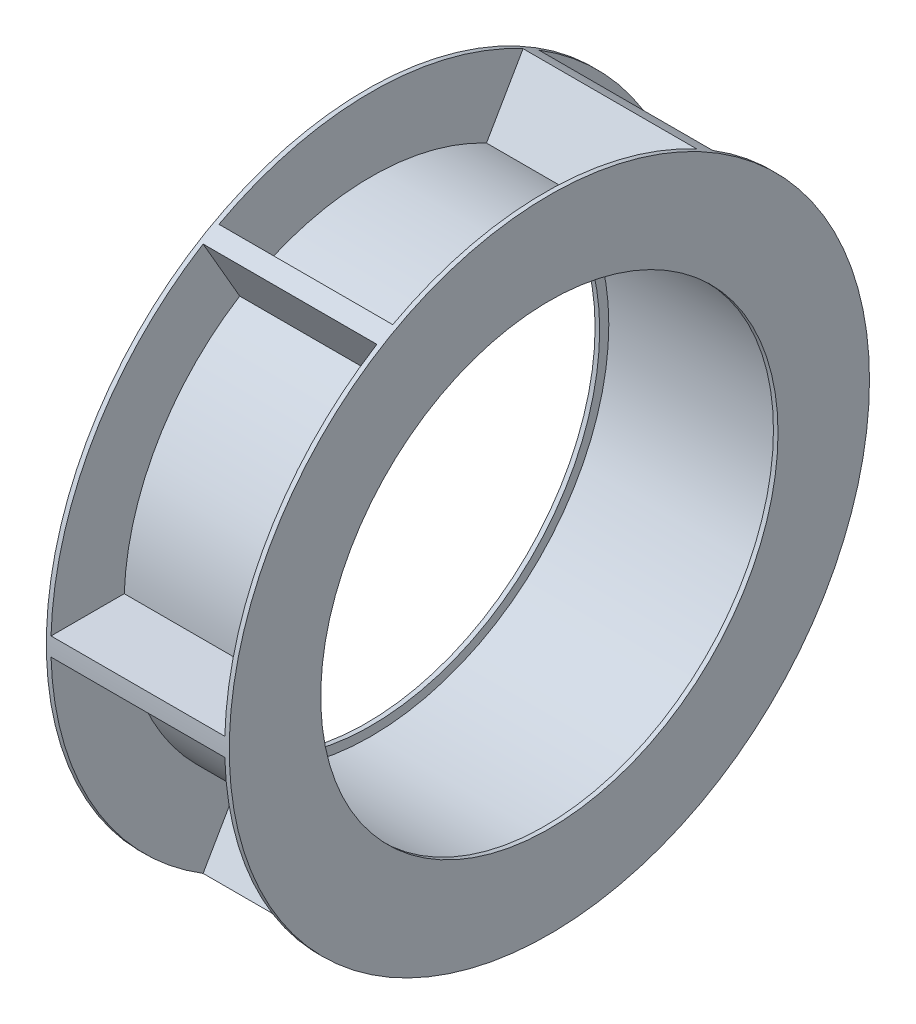
from build123d import *

# Parameters (mm, degrees)
SKETCH8_R               = 175
SKETCH8_R_2             = 125
BOSS_EXTRUDE7_DEPTH     = 50
SKETCH9_R               = 130
SKETCH9_R_2             = 125
CUT_EXTRUDE2_DEPTH      = 47.5
CUT_EXTRUDE3_DEPTH      = 267.926956301
CUT_EXTRUDE3_DEPTH_BACK = 267.926956301
SKETCH11_R              = 175
SKETCH11_R_2            = 125
BOSS_EXTRUDE8_DEPTH     = 2.5


with BuildPart() as part:
    # Sketch8 → Boss-Extrude7 (new, symmetric)
    with BuildSketch(Plane.YZ):
        Circle(SKETCH8_R)
        Circle(SKETCH8_R_2, mode=Mode.SUBTRACT)
    extrude(amount=BOSS_EXTRUDE7_DEPTH, both=True)

    # Sketch9 → Cut-Extrude2 (cut, symmetric)
    with BuildSketch(Plane.YZ):
        Circle(SKETCH9_R)
        Circle(SKETCH9_R_2, mode=Mode.SUBTRACT)
    extrude(amount=CUT_EXTRUDE2_DEPTH, both=True, mode=Mode.SUBTRACT)

    # Sketch10 → Cut-Extrude3 (cut, two sides: drawn at the far end of the back side and taken through both)
    with BuildSketch(Plane.YZ.offset(50).offset(-CUT_EXTRUDE3_DEPTH_BACK)):
        with BuildLine():
            Line((114.333214455, 71.783814835), (148.992574075, 91.794405442))
            ThreePointArc((148.992574075, 91.794405442), (87.5, 151.554445662), (5, 174.928556845))
            Line((5, 174.928556845), (5, 134.907375632))
            ThreePointArc((5, 134.907375632), (67.5, 116.913429511), (114.333214455, 71.783814835))
        make_face()
        with BuildLine():
            ThreePointArc((153.992574075, -83.134151404), (175, 0), (153.992574075, 83.134151404))
            Line((153.992574075, 83.134151404), (119.333214455, 63.123560797))
            ThreePointArc((119.333214455, 63.123560797), (135, 0), (119.333214455, -63.123560797))
            Line((119.333214455, -63.123560797), (153.992574075, -83.134151404))
        make_face()
        with BuildLine():
            ThreePointArc((-114.333214455, 71.783814835), (-67.5, 116.913429511), (-5, 134.907375632))
            Line((-5, 134.907375632), (-5, 174.928556845))
            ThreePointArc((-5, 174.928556845), (-87.5, 151.554445662), (-148.992574075, 91.794405442))
            Line((-148.992574075, 91.794405442), (-114.333214455, 71.783814835))
        make_face()
        with BuildLine():
            Line((148.992574075, -91.794405442), (114.333214455, -71.783814835))
            ThreePointArc((114.333214455, -71.783814835), (67.5, -116.913429511), (5, -134.907375632))
            Line((5, -134.907375632), (5, -174.928556845))
            ThreePointArc((5, -174.928556845), (87.5, -151.554445662), (148.992574075, -91.794405442))
        make_face()
        with BuildLine():
            ThreePointArc((-119.333214455, -63.123560797), (-135, 0), (-119.333214455, 63.123560797))
            Line((-119.333214455, 63.123560797), (-153.992574075, 83.134151404))
            ThreePointArc((-153.992574075, 83.134151404), (-175, 0), (-153.992574075, -83.134151404))
            Line((-153.992574075, -83.134151404), (-119.333214455, -63.123560797))
        make_face()
        with BuildLine():
            Line((-5, -174.928556845), (-5, -134.907375632))
            ThreePointArc((-5, -134.907375632), (-67.5, -116.913429511), (-114.333214455, -71.783814835))
            Line((-114.333214455, -71.783814835), (-148.992574075, -91.794405442))
            ThreePointArc((-148.992574075, -91.794405442), (-87.5, -151.554445662), (-5, -174.928556845))
        make_face()
    extrude(amount=CUT_EXTRUDE3_DEPTH + CUT_EXTRUDE3_DEPTH_BACK, mode=Mode.SUBTRACT)

    # Sketch11 → Boss-Extrude8 (add)
    with BuildSketch(Plane.YZ.offset(50)):
        Circle(SKETCH11_R)
        Circle(SKETCH11_R_2, mode=Mode.SUBTRACT)
    boss_extrude8 = extrude(amount=-BOSS_EXTRUDE8_DEPTH)

    # Mirror3: Boss-Extrude8 across plane
    add(boss_extrude8.mirror(Plane(origin=(0, 0, 0), x_dir=(0, 0, 1), z_dir=(1, 0, 0))))


solid = part.part
